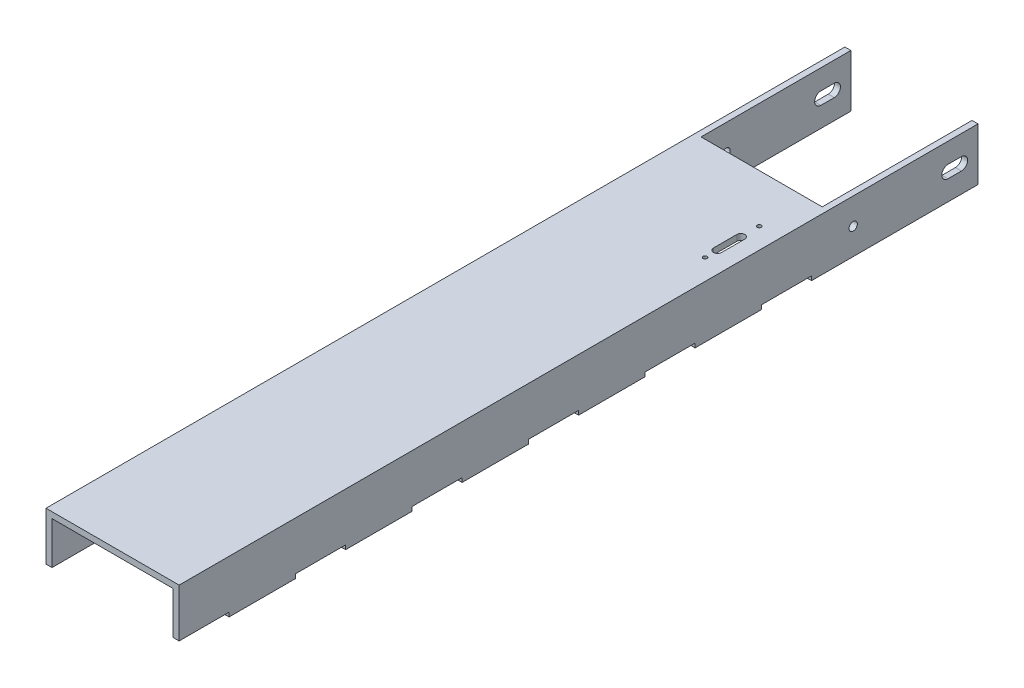
from build123d import *

# Parameters (mm, degrees)
BOSS_EXTRUDE1_DEPTH = 609.6
SKETCH3_R           = 1.524
SKETCH3_W           = 92.456
SKETCH3_H           = 114.3
CUT_EXTRUDE1_DEPTH  = 614.028039672
SKETCH4_R           = 3.175
SKETCH4_W           = 38.1
SKETCH4_H           = 3.175
CUT_EXTRUDE2_DEPTH  = 620.310340156


with BuildPart() as part:
    # Sketch1 → Boss-Extrude1 (new body)
    with BuildSketch(Plane.XY):
        Polygon((-50.8, 0), (50.8, 0), (50.8, -40.132), (46.228, -40.132), (46.228, -4.572), (-46.228, -4.572), (-46.228, -40.132), (-50.8, -40.132), align=None)
    extrude(amount=BOSS_EXTRUDE1_DEPTH)

    # Sketch3 → Cut-Extrude1 (cut, through all)
    with BuildSketch(Plane(origin=(0, 0, 0), x_dir=(1, 0, 0), z_dir=(0, 1, 0))):
        with Locations((34.925, -151.13)):
            Circle(SKETCH3_R)
        with Locations((34.925, -192.405)):
            Circle(SKETCH3_R)
        with Locations((0, -57.15)):
            Rectangle(SKETCH3_W, SKETCH3_H)
        with BuildLine():
            Line((37.973, -165.1), (37.973, -182.88))
            ThreePointArc((37.973, -182.88), (34.925, -185.928), (31.877, -182.88))
            Line((31.877, -182.88), (31.877, -165.1))
            ThreePointArc((31.877, -165.1), (34.925, -162.052), (37.973, -165.1))
        make_face()
    extrude(amount=-CUT_EXTRUDE1_DEPTH, mode=Mode.SUBTRACT)

    # Sketch4 → Cut-Extrude2 (cut, through all)
    with BuildSketch(Plane(origin=(50.8, 0, 0), x_dir=(0, 0, -1), z_dir=(1, 0, 0))):
        with Locations((-95.25, -20.066)):
            Circle(SKETCH4_R)
        with BuildLine():
            Line((-12.7, -24.8285), (-22.86, -24.8285))
            ThreePointArc((-22.86, -24.8285), (-27.6225, -20.066), (-22.86, -15.3035))
            Line((-22.86, -15.3035), (-12.7, -15.3035))
            ThreePointArc((-12.7, -15.3035), (-7.9375, -20.066), (-12.7, -24.8285))
        make_face()
        with Locations((-501.65, -38.5445)):
            Rectangle(SKETCH4_W, SKETCH4_H)
        with Locations((-590.55, -38.5445)):
            Rectangle(SKETCH4_W, SKETCH4_H)
        with Locations((-412.75, -38.5445)):
            Rectangle(SKETCH4_W, SKETCH4_H)
        with Locations((-323.85, -38.5445)):
            Rectangle(SKETCH4_W, SKETCH4_H)
        with Locations((-234.95, -38.5445)):
            Rectangle(SKETCH4_W, SKETCH4_H)
        with Locations((-146.05, -38.5445)):
            Rectangle(SKETCH4_W, SKETCH4_H)
    extrude(amount=-CUT_EXTRUDE2_DEPTH, mode=Mode.SUBTRACT)


solid = part.part
